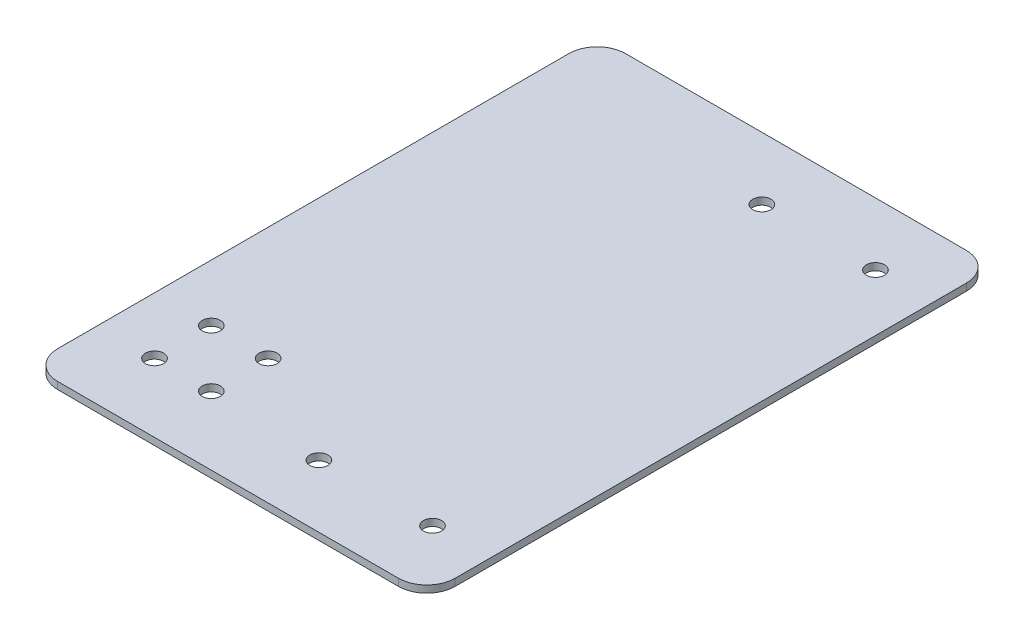
from build123d import *

# Parameters (mm, degrees)
SKETCH1_W           = 241.3
SKETCH1_H           = 127
SKETCH1_R           = 2.032
BOSS_EXTRUDE1_DEPTH = 1.5875
SKETCH2_W           = 152.4
SKETCH2_H           = 127
CUT_EXTRUDE1_DEPTH  = 137.349523858
FILLET2_R           = 6.35


with BuildPart() as part:
    # Sketch1 → Boss-Extrude1 (new body)
    with BuildSketch(Plane(origin=(0, 0, 0), x_dir=(1, 0, 0), z_dir=(0, 1, 0))):
        Rectangle(SKETCH1_W, SKETCH1_H)
        with Locations((44.45, -48.1965)):
            Circle(SKETCH1_R, mode=Mode.SUBTRACT)
        with Locations((57.15, -48.1965)):
            Circle(SKETCH1_R, mode=Mode.SUBTRACT)
        with Locations((44.45, -35.4965)):
            Circle(SKETCH1_R, mode=Mode.SUBTRACT)
        with Locations((57.15, -35.4965)):
            Circle(SKETCH1_R, mode=Mode.SUBTRACT)
        with Locations((82.55, -49.53)):
            Circle(SKETCH1_R, mode=Mode.SUBTRACT)
        with Locations((107.95, -49.53)):
            Circle(SKETCH1_R, mode=Mode.SUBTRACT)
        with Locations((82.55, 49.53)):
            Circle(SKETCH1_R, mode=Mode.SUBTRACT)
        with Locations((107.95, 49.53)):
            Circle(SKETCH1_R, mode=Mode.SUBTRACT)
    extrude(amount=BOSS_EXTRUDE1_DEPTH)

    # Sketch2 → Cut-Extrude1 (cut, through all)
    with BuildSketch(Plane(origin=(0, 1.5875, 0), x_dir=(1, 0, 0), z_dir=(0, 1, 0))):
        with Locations((-44.45, 0)):
            Rectangle(SKETCH2_W, SKETCH2_H)
    extrude(amount=-CUT_EXTRUDE1_DEPTH, mode=Mode.SUBTRACT)

    # Fillet2
    fillet2_edges = [part.edges().sort_by_distance(p)[0] for p in [
        (120.65, 0.79375, -63.5),
        (120.65, 0.79375, 63.5),
        (31.75, 0.79375, -63.5),
        (31.75, 0.79375, 63.5),
    ]]
    fillet(fillet2_edges, radius=FILLET2_R)


solid = part.part
